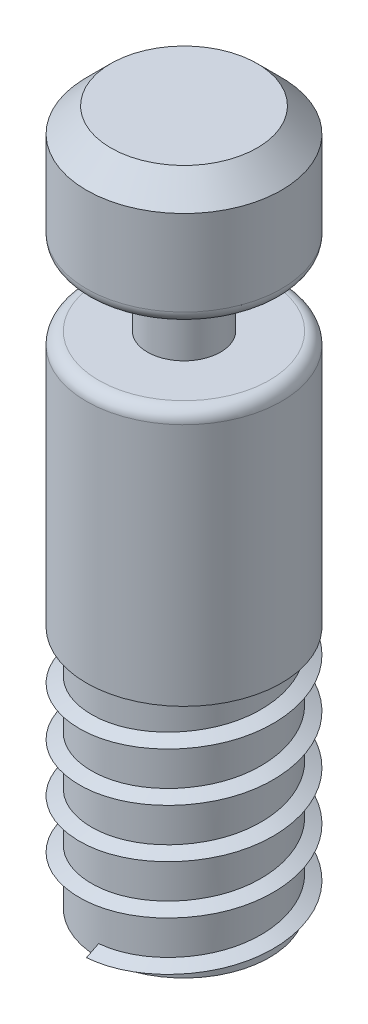
from build123d import *

# Parameters (mm, degrees)
SWEEP1_PITCH = 2


with BuildPart() as part:
    # Sketch1 → Revolve1 (revolve)
    with BuildSketch(Plane(origin=(0, 0, 0), x_dir=(0, 0, -1), z_dir=(1, 0, 0))):
        with BuildLine():
            Line((0, 0), (-3, 0))
            Line((-3, 0), (-4, -1))
            Line((-4, -1), (-4, -4.5))
            ThreePointArc((-4, -4.5), (-3.853553391, -4.853553391), (-3.5, -5))
            Line((-3.5, -5), (-1.5, -5))
            Line((-1.5, -5), (-1.5, -8))
            Line((-1.5, -8), (-3.5, -8))
            ThreePointArc((-3.5, -8), (-3.853553391, -8.146446609), (-4, -8.5))
            Line((-4, -8.5), (-4, -18.5))
            Line((-4, -18.5), (-3.5, -18.5))
            Line((-3.5, -18.5), (-3.5, -28.5))
            Line((-3.5, -28.5), (0, -28.5))
            Line((0, -28.5), (0, 0))
        make_face()
    revolve(axis=Axis((0, 0, 0), (0, -1, 0)))

    # Sweep1: the profile of Sketch3 profile screwed along a right-hand helix of 5 turns, 6 arcs to a turn; built about Z, then put on its axis
    sweep1_z = Axis((0, 0, 0), (0, 0, 1))
    sweep1_corners = [(3.4997, 0, -0.00015), (4, 0, 0.25), (3.4997, 0, 0.50015)]
    with BuildLine(mode=Mode.PRIVATE) as sweep1_profile:
        Line(sweep1_corners[0], sweep1_corners[1])
        Line(sweep1_corners[1], sweep1_corners[2])
        Line(sweep1_corners[2], sweep1_corners[0])
    sweep1_cap = Face(sweep1_profile.wire())
    sweep1_turn_angles = [0, 30, 60, 90, 120, 150, 180, 210, 240, 270, 300, 330, 360]
    sweep1_turn_weights = [1, 0.8660254037844387, 1, 0.8660254037844387, 1, 0.8660254037844387, 1, 0.8660254037844387, 1, 0.8660254037844387, 1, 0.8660254037844387, 1]
    sweep1_turn_rails = [Edge.make_bspline([Vector(p[0], p[1], 0).rotate(sweep1_z, sweep1_turn_angles[k]) / sweep1_turn_weights[k] + Vector(0, 0, p[2] + SWEEP1_PITCH * sweep1_turn_angles[k] / 360) for k in range(13)], [0, 0, 0, 1, 1, 2, 2, 3, 3, 4, 4, 5, 5, 6, 6, 6], 2, sweep1_turn_weights) for p in sweep1_corners]
    sweep1_turn_sides = [Face.make_surface_from_curves(sweep1_turn_rails[p[0]], sweep1_turn_rails[p[1]]) for p in [(0, 1), (1, 2), (2, 0)]]
    sweep1 = Plane(origin=(0, -28.5, 0), x_dir=(0, 0, 1), z_dir=(0, 1, 0)) * Solid(Shell([*[p.moved(Location((0, 0, SWEEP1_PITCH * i))) for i in range(5) for p in sweep1_turn_sides], sweep1_cap, sweep1_cap.rotate(sweep1_z, 1800).moved(Location((0, 0, SWEEP1_PITCH * 1800 / 360)))]))
    add(sweep1)


solid = part.part
